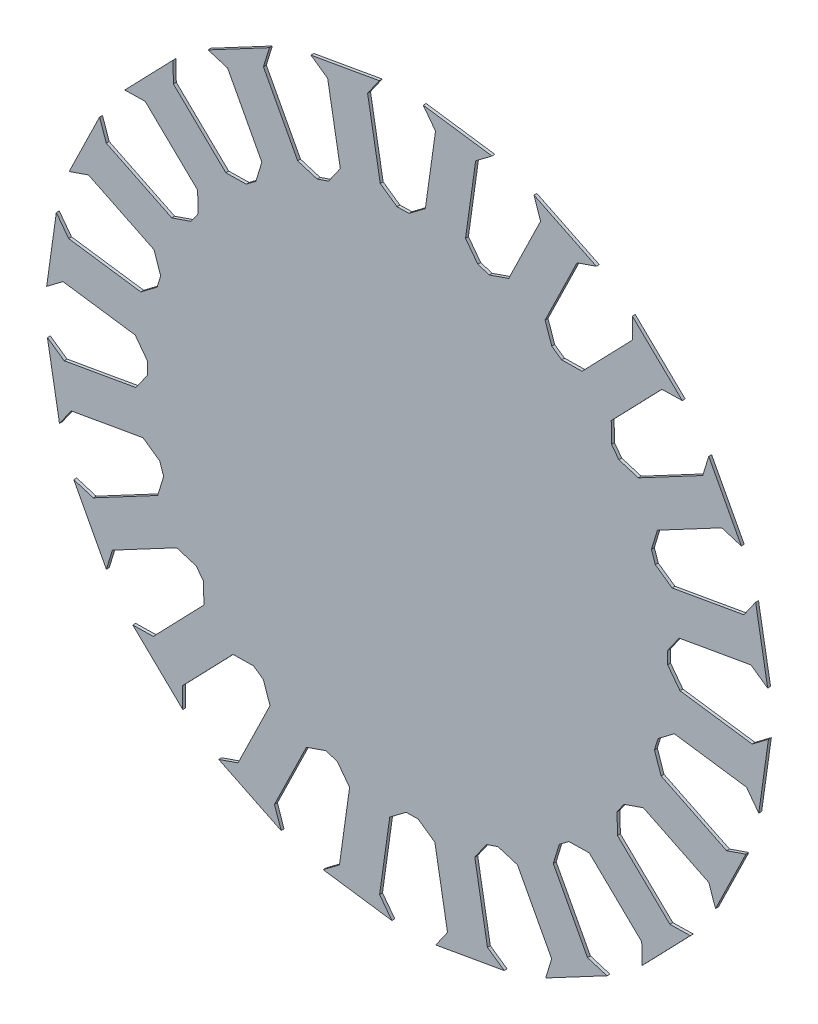
from build123d import *

# Parameters (mm, degrees)
Y_KSEKLIK_EKSTR_ZYON1_DEPTH = 1


with BuildPart() as part:
    # Çizim1 → Yükseklik-Ekstrüzyon1 (new body)
    with BuildSketch(Plane.XY):
        Polygon((-3.655966564, 89.925713278), (-1.570294625, 89.962118817), (0.515377314, 89.998524356), (6.162583162, 94.253999195), (9.673478824, 119.235319882), (5.418003985, 124.882525731), (29.214169481, 121.538192769), (23.566963633, 117.28271793), (20.056067971, 92.301397243), (24.31154281, 86.654191394), (26.306384629, 86.044307046), (28.301226447, 85.434422697), (34.987052413, 87.736537195), (46.045765244, 110.410258595), (43.743650746, 117.096084561), (65.341693285, 106.562015365), (58.655867319, 104.259900868), (47.597154488, 81.586179467), (49.899268986, 74.900353502), (51.608011668, 73.703878995), (53.31675435, 72.507404488), (60.386745204, 72.630811638), (77.910771342, 90.777471923), (77.787364193, 97.847462777), (95.073116887, 81.154805437), (88.003126033, 81.031398287), (70.479099894, 62.884738001), (70.602507044, 55.814747147), (71.85788695, 54.148801743), (73.113266857, 52.482856339), (79.875362635, 50.415476189), (102.149328305, 62.258753816), (104.216708455, 69.020849594), (115.498121395, 47.803597713), (108.736025616, 49.870977863), (86.462059946, 38.027700236), (84.394679796, 31.265604458), (85.073811595, 29.2932625), (85.752943394, 27.320920542), (91.545223047, 23.265122665), (116.388797298, 27.645715103), (120.444595174, 33.437994756), (124.617365058, 9.773040778), (118.825085404, 13.828838655), (93.981511154, 9.448246217), (89.925713278, 3.655966564), (89.962118817, 1.570294625), (89.998524356, -0.515377314), (94.253999195, -6.162583162), (119.235319882, -9.673478823), (124.882525731, -5.418003985), (121.538192769, -29.214169481), (117.28271793, -23.566963633), (92.301397243, -20.056067971), (86.654191394, -24.31154281), (86.044307046, -26.306384629), (85.434422697, -28.301226447), (87.736537195, -34.987052413), (110.410258595, -46.045765244), (117.096084561, -43.743650746), (106.562015365, -65.341693284), (104.259900868, -58.655867319), (81.586179467, -47.597154488), (74.900353502, -49.899268986), (73.703878995, -51.608011668), (72.507404488, -53.31675435), (72.630811638, -60.386745204), (90.777471923, -77.910771342), (97.847462777, -77.787364193), (81.154805437, -95.073116887), (81.031398287, -88.003126033), (62.884738001, -70.479099894), (55.814747147, -70.602507044), (54.148801743, -71.85788695), (52.482856339, -73.113266857), (50.415476189, -79.875362635), (62.258753816, -102.149328305), (69.020849594, -104.216708455), (47.803597713, -115.498121395), (49.870977863, -108.736025616), (38.027700236, -86.462059946), (31.265604458, -84.394679796), (29.2932625, -85.073811595), (27.320920542, -85.752943394), (23.265122665, -91.545223047), (27.645715103, -116.388797297), (33.437994756, -120.444595174), (9.773040778, -124.617365058), (13.828838655, -118.825085404), (9.448246217, -93.981511154), (3.655966564, -89.925713278), (1.570294625, -89.962118817), (-0.515377314, -89.998524356), (-6.162583162, -94.253999195), (-9.673478823, -119.235319882), (-5.418003985, -124.88252573), (-29.214169481, -121.538192769), (-23.566963633, -117.28271793), (-20.056067971, -92.301397243), (-24.31154281, -86.654191394), (-26.306384629, -86.044307046), (-28.301226447, -85.434422697), (-34.987052413, -87.736537195), (-46.045765244, -110.410258595), (-43.743650746, -117.096084561), (-65.341693284, -106.562015365), (-58.655867319, -104.259900868), (-47.597154488, -81.586179467), (-49.899268986, -74.900353502), (-51.608011668, -73.703878995), (-53.31675435, -72.507404488), (-60.386745204, -72.630811638), (-77.910771342, -90.777471923), (-77.787364193, -97.847462777), (-95.073116887, -81.154805437), (-88.003126033, -81.031398287), (-70.479099894, -62.884738001), (-70.602507044, -55.814747147), (-71.85788695, -54.148801743), (-73.113266857, -52.482856339), (-79.875362635, -50.415476189), (-102.149328305, -62.258753816), (-104.216708455, -69.020849594), (-115.498121395, -47.803597713), (-108.736025616, -49.870977863), (-86.462059946, -38.027700236), (-84.394679796, -31.265604458), (-85.073811595, -29.2932625), (-85.752943394, -27.320920542), (-91.545223047, -23.265122665), (-116.388797297, -27.645715103), (-120.444595174, -33.437994756), (-124.617365058, -9.773040778), (-118.825085404, -13.828838655), (-93.981511154, -9.448246217), (-89.925713278, -3.655966564), (-89.962118817, -1.570294625), (-89.998524356, 0.515377314), (-94.253999195, 6.162583162), (-119.235319882, 9.673478824), (-124.88252573, 5.418003985), (-121.538192769, 29.214169481), (-117.28271793, 23.566963633), (-92.301397243, 20.056067971), (-86.654191394, 24.31154281), (-86.044307046, 26.306384629), (-85.434422697, 28.301226447), (-87.736537195, 34.987052413), (-110.410258595, 46.045765244), (-117.096084561, 43.743650746), (-106.562015365, 65.341693284), (-104.259900868, 58.655867319), (-81.586179467, 47.597154488), (-74.900353502, 49.899268986), (-73.703878995, 51.608011668), (-72.507404488, 53.31675435), (-72.630811638, 60.386745204), (-90.777471923, 77.910771342), (-97.847462777, 77.787364193), (-81.154805437, 95.073116887), (-81.031398287, 88.003126033), (-62.884738001, 70.479099894), (-55.814747147, 70.602507044), (-54.148801743, 71.85788695), (-52.482856339, 73.113266857), (-50.415476189, 79.875362635), (-62.258753816, 102.149328305), (-69.020849594, 104.216708455), (-47.803597713, 115.498121395), (-49.870977863, 108.736025616), (-38.027700236, 86.462059946), (-31.265604458, 84.394679796), (-29.2932625, 85.073811595), (-27.320920542, 85.752943394), (-23.265122665, 91.545223047), (-27.645715103, 116.388797298), (-33.437994756, 120.444595174), (-9.773040778, 124.617365058), (-13.828838655, 118.825085404), (-9.448246217, 93.981511154), align=None)
    extrude(amount=Y_KSEKLIK_EKSTR_ZYON1_DEPTH)


solid = part.part
